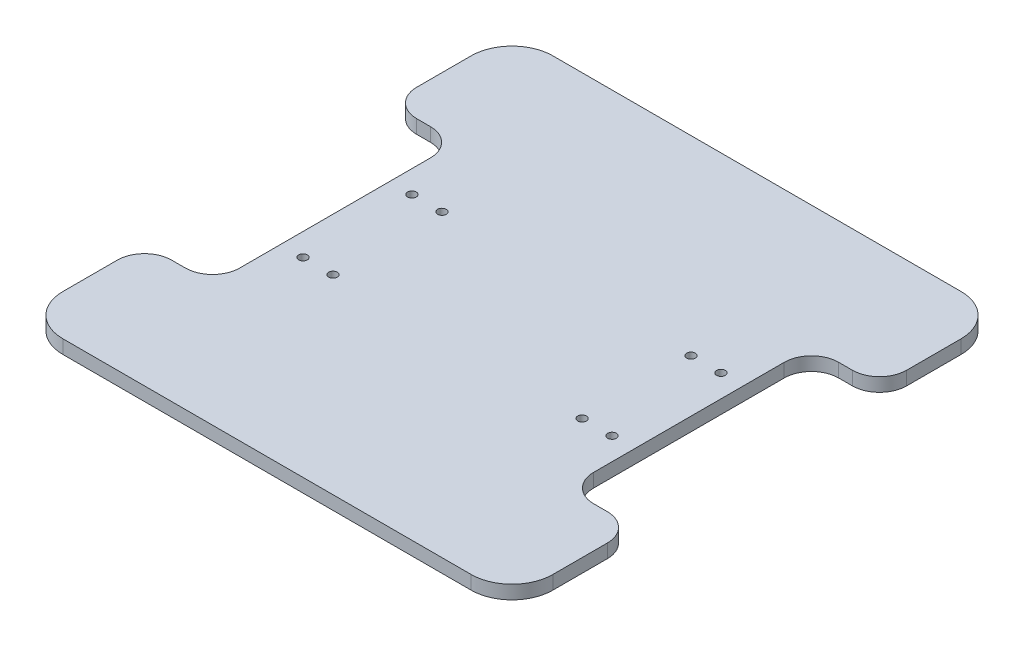
from build123d import *

# Parameters (mm, degrees)
SKETCH1_W           = 180
SKETCH1_H           = 180
BOSS_EXTRUDE1_DEPTH = 5
FILLET1_R           = 15
SKETCH2_R           = 1.6
SKETCH2_W           = 25
SKETCH2_H           = 90
CUT_EXTRUDE2_DEPTH  = 128.377392029
FILLET2_R           = 10


with BuildPart() as part:
    # Sketch1 → Boss-Extrude1 (new body)
    with BuildSketch(Plane(origin=(0, 0, 0), x_dir=(1, 0, 0), z_dir=(0, 1, 0))):
        Rectangle(SKETCH1_W, SKETCH1_H)
    extrude(amount=BOSS_EXTRUDE1_DEPTH)

    # Fillet1
    fillet1_edges = [part.edges().sort_by_distance(p)[0] for p in [
        (-90, 2.5, -90),
        (90, 2.5, -90),
        (-90, 2.5, 90),
        (90, 2.5, 90),
    ]]
    fillet(fillet1_edges, radius=FILLET1_R)

    # Sketch2 → Cut-Extrude2 (cut, through all)
    with BuildSketch(Plane(origin=(0, 5, 0), x_dir=(1, 0, 0), z_dir=(0, 1, 0))):
        with Locations((-56.75, 20)):
            Circle(SKETCH2_R)
        with Locations((-45.75, 20)):
            Circle(SKETCH2_R)
        with Locations((-56.75, -20)):
            Circle(SKETCH2_R)
        with Locations((-45.75, -20)):
            Circle(SKETCH2_R)
        with Locations((45.75, 20)):
            Circle(SKETCH2_R)
        with Locations((56.75, 20)):
            Circle(SKETCH2_R)
        with Locations((45.75, -20)):
            Circle(SKETCH2_R)
        with Locations((56.75, -20)):
            Circle(SKETCH2_R)
        with Locations((-77.5, 0)):
            Rectangle(SKETCH2_W, SKETCH2_H)
        with Locations((77.5, 0)):
            Rectangle(SKETCH2_W, SKETCH2_H)
    extrude(amount=-CUT_EXTRUDE2_DEPTH, mode=Mode.SUBTRACT)

    # Fillet2
    fillet2_edges = [part.edges().sort_by_distance(p)[0] for p in [
        (-65, 2.5, 45),
        (-65, 2.5, -45),
        (65, 2.5, -45),
        (65, 2.5, 45),
        (90, 2.5, -45),
        (90, 2.5, 45),
        (-90, 2.5, 45),
        (-90, 2.5, -45),
    ]]
    fillet(fillet2_edges, radius=FILLET2_R)


solid = part.part
